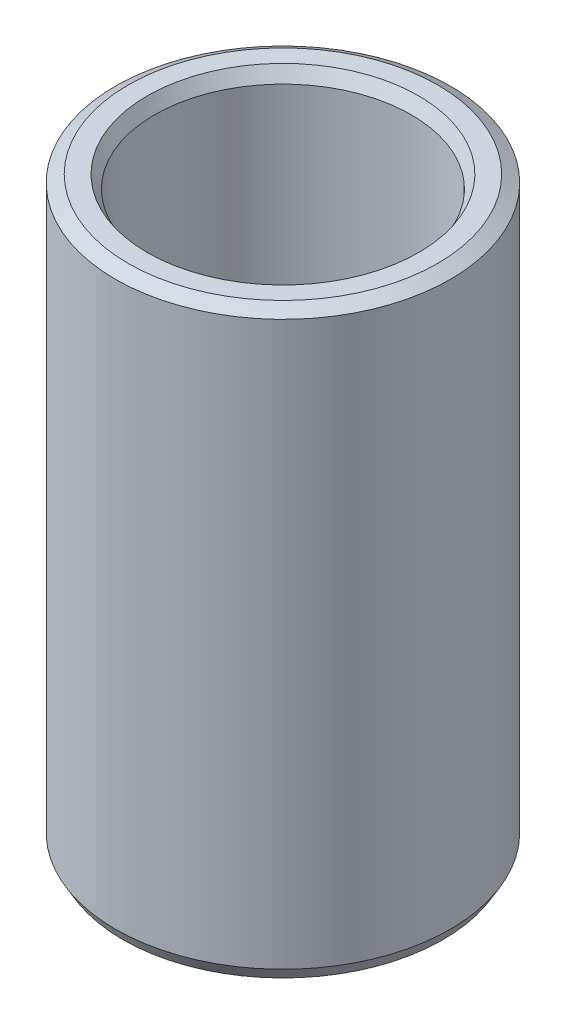
from build123d import *
from OCP.BRepFilletAPI import BRepFilletAPI_MakeChamfer

# Parameters (mm, degrees)
SKETCH1_R           = 27.5
BOSS_EXTRUDE1_DEPTH = 95.755072461
SKETCH2_R           = 21.089090415
CUT_EXTRUDE1_DEPTH  = 104.35150653
CHAMFER1_SIZE       = 1.207840175
CHAMFER1_SIZE2      = 2.092040551


with BuildPart() as part:
    # Sketch1 → Boss-Extrude1 (new body)
    with BuildSketch(Plane(origin=(0, 0, 0), x_dir=(1, 0, 0), z_dir=(0, 1, 0))):
        Circle(SKETCH1_R)
    extrude(amount=BOSS_EXTRUDE1_DEPTH)

    # Sketch2 → Cut-Extrude1 (cut, through all)
    with BuildSketch(Plane(origin=(0, 0, 0), x_dir=(1, 0, 0), z_dir=(0, 1, 0))):
        Circle(SKETCH2_R)
    extrude(amount=CUT_EXTRUDE1_DEPTH, mode=Mode.SUBTRACT)

    # Chamfer1: one chamfer whose edges measure the first distance from different faces: ONE call of the kernel's chamfer builder (chamfer() names one face for all edges)
    chamfer1_edges_1 = [part.edges().sort_by_distance(p)[0] for p in [
        (-21.089090415, 95.755072461, 0),
    ]]
    chamfer1_side_1 = [part.faces().sort_by_distance(p)[0] for p in [
        (-26.722182541, 95.755072461, 0),
    ]]
    chamfer1_edges_2 = [part.edges().sort_by_distance(p)[0] for p in [
        (-21.089090415, 0, 0),
    ]]
    chamfer1_side_2 = [part.faces().sort_by_distance(p)[0] for p in [
        (-21.089090415, 47.87753623, 0),
    ]]
    chamfer1_edges_3 = [part.edges().sort_by_distance(p)[0] for p in [
        (-27.5, 0, 0),
    ]]
    chamfer1_side_3 = [part.faces().sort_by_distance(p)[0] for p in [
        (-26.722182541, 0, 0),
    ]]
    chamfer1_edges_4 = [part.edges().sort_by_distance(p)[0] for p in [
        (-27.5, 95.755072461, 0),
    ]]
    chamfer1_side_4 = [part.faces().sort_by_distance(p)[0] for p in [
        (-27.5, 47.87753623, 0),
    ]]
    chamfer1 = BRepFilletAPI_MakeChamfer(part.part.solid().wrapped)
    for e in chamfer1_edges_1:
        chamfer1.Add(CHAMFER1_SIZE, CHAMFER1_SIZE2, e.wrapped, chamfer1_side_1[0].wrapped)  # the first distance lies on this face
    for e in chamfer1_edges_2:
        chamfer1.Add(CHAMFER1_SIZE, CHAMFER1_SIZE2, e.wrapped, chamfer1_side_2[0].wrapped)  # the first distance lies on this face
    for e in chamfer1_edges_3:
        chamfer1.Add(CHAMFER1_SIZE, CHAMFER1_SIZE2, e.wrapped, chamfer1_side_3[0].wrapped)  # the first distance lies on this face
    for e in chamfer1_edges_4:
        chamfer1.Add(CHAMFER1_SIZE, CHAMFER1_SIZE2, e.wrapped, chamfer1_side_4[0].wrapped)  # the first distance lies on this face
    add(Compound.cast(chamfer1.Shape()), mode=Mode.REPLACE)


solid = part.part
